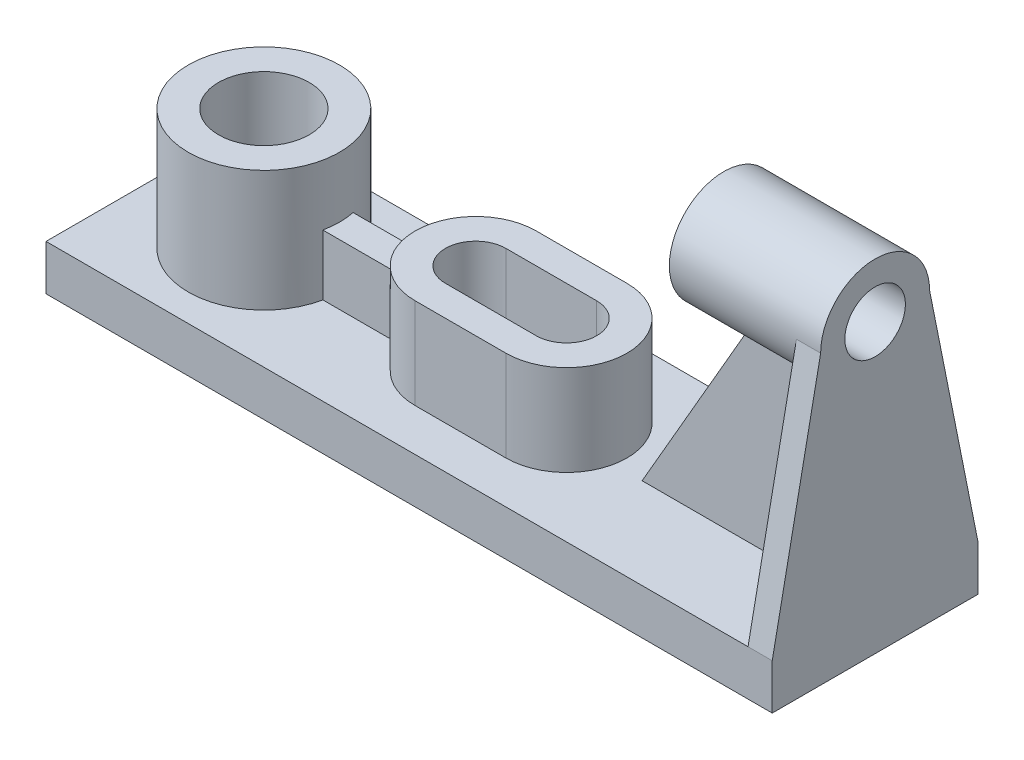
from build123d import *
from build123d.topology import SkipClean

# Parameters (mm, degrees)
SKETCH2_W           = 240
SKETCH2_H           = 68
BOSS_EXTRUDE1_DEPTH = 15
SKETCH4_R           = 25
SKETCH4_R_2         = 15
BOSS_EXTRUDE4_DEPTH = 40
CUT_EXTRUDE2_START  = -40
SKETCH7_R           = 15
CUT_EXTRUDE2_DEPTH  = 40
BOSS_EXTRUDE5_DEPTH = 30
CUT_EXTRUDE3_DEPTH  = 77
RIB3_REACH          = 138.312
SKETCH11_WALL_W     = 299.624283584
SKETCH11_WALL_H     = 10
BOSS_EXTRUDE6_DEPTH = 8
SKETCH13_R          = 18
BOSS_EXTRUDE7_DEPTH = 42
SKETCH14_R          = 10
CUT_EXTRUDE4_DEPTH  = 67
RIB14_REACH         = 170.3
SKETCH19_WALL_W     = 410.192086974
SKETCH19_WALL_H     = 8


with BuildPart() as part:
    # Sketch2 → Boss-Extrude1 (new body)
    with BuildSketch(Plane(origin=(0, 0, 0), x_dir=(1, 0, 0), z_dir=(0, 1, 0))):
        Rectangle(SKETCH2_W, SKETCH2_H)
    extrude(amount=BOSS_EXTRUDE1_DEPTH)

    # Sketch4 → Boss-Extrude4 (add)
    with BuildSketch(Plane(origin=(0, 15, 0), x_dir=(1, 0, 0), z_dir=(0, 1, 0))):
        with Locations((-82, 0)):
            Circle(SKETCH4_R)
        with Locations((-82, 0)):
            Circle(SKETCH4_R_2, mode=Mode.SUBTRACT)
    extrude(amount=BOSS_EXTRUDE4_DEPTH)

    # Sketch7 → Cut-Extrude2 (cut)
    with BuildSketch(Plane(origin=(0, 15, 0), x_dir=(1, 0, 0), z_dir=(0, 1, 0)).offset(CUT_EXTRUDE2_START)):
        with Locations((-82, 0)):
            Circle(SKETCH7_R)
    extrude(amount=CUT_EXTRUDE2_DEPTH, mode=Mode.SUBTRACT)

    # Sketch8 → Boss-Extrude5 (add)
    with BuildSketch(Plane(origin=(0, 15, 0), x_dir=(1, 0, 0), z_dir=(0, 1, 0))):
        with BuildLine():
            Line((-12, 20), (18, 20))
            ThreePointArc((18, 20), (38, 0), (18, -20))
            Line((18, -20), (-12, -20))
            ThreePointArc((-12, -20), (-32, 0), (-12, 20))
        make_face()
    extrude(amount=BOSS_EXTRUDE5_DEPTH)

    # Sketch9 → Cut-Extrude3 (cut)
    with BuildSketch(Plane(origin=(0, 45, 0), x_dir=(1, 0, 0), z_dir=(0, 1, 0))):
        with BuildLine():
            Line((-12, -10), (18, -10))
            ThreePointArc((18, -10), (28, 0), (18, 10))
            Line((18, 10), (-12, 10))
            ThreePointArc((-12, 10), (-22, 0), (-12, -10))
        make_face()
    extrude(amount=-CUT_EXTRUDE3_DEPTH, mode=Mode.SUBTRACT)

    # Sketch11 wall → Rib3 (add, up to next)
    with BuildSketch(Plane(origin=(-44.5, 35, 0), x_dir=(1, 0, 0), z_dir=(0, 1, 0)), mode=Mode.PRIVATE) as rib3_sk1:
        Rectangle(SKETCH11_WALL_W, SKETCH11_WALL_H)
    rib3_tool1 = extrude(rib3_sk1.sketch, amount=-RIB3_REACH, mode=Mode.PRIVATE) - part.part
    add(rib3_tool1.solids().sort_by_distance((-44.5, 35, 0))[0])

    # Sketch12 → Boss-Extrude6 (add)
    with BuildSketch(Plane(origin=(120, 0, 0), x_dir=(0, 0, -1), z_dir=(1, 0, 0))):
        with BuildLine():
            Line((-18, 95), (-34, 15))
            Line((-34, 15), (34, 15))
            Line((34, 15), (18, 95))
            ThreePointArc((18, 95), (0, 113), (-18, 95))
        make_face()
    extrude(amount=-BOSS_EXTRUDE6_DEPTH)

    # Sketch13 → Boss-Extrude7 (add)
    with SkipClean():  # the faces are left unmerged after this step: merging them gives an invalid solid
        with BuildSketch(Plane.ZY.offset(-112)):
            with Locations((0, 95)):
                Circle(SKETCH13_R)
        extrude(amount=BOSS_EXTRUDE7_DEPTH)
    add(part.part.scale(1), mode=Mode.REPLACE)  # the faces are merged on a copy

    # Sketch14 → Cut-Extrude4 (cut)
    with BuildSketch(Plane.ZY.offset(-70)):
        with Locations((0, 95)):
            Circle(SKETCH14_R)
    extrude(amount=-CUT_EXTRUDE4_DEPTH, mode=Mode.SUBTRACT)

    # Sketch19 wall → Rib14 (add, up to next)
    with BuildSketch(Plane(origin=(64.897858345, 46, 0), x_dir=(-0.500000000003, -0.866025403783, 0), z_dir=(0.866025403783, -0.500000000003, 0)), mode=Mode.PRIVATE) as rib14_sk1:
        Rectangle(SKETCH19_WALL_W, SKETCH19_WALL_H)
    rib14_tool1 = extrude(rib14_sk1.sketch, amount=RIB14_REACH, mode=Mode.PRIVATE) - part.part
    add(rib14_tool1.solids().sort_by_distance((64.897858345, 46, 0))[0])


solid = part.part
